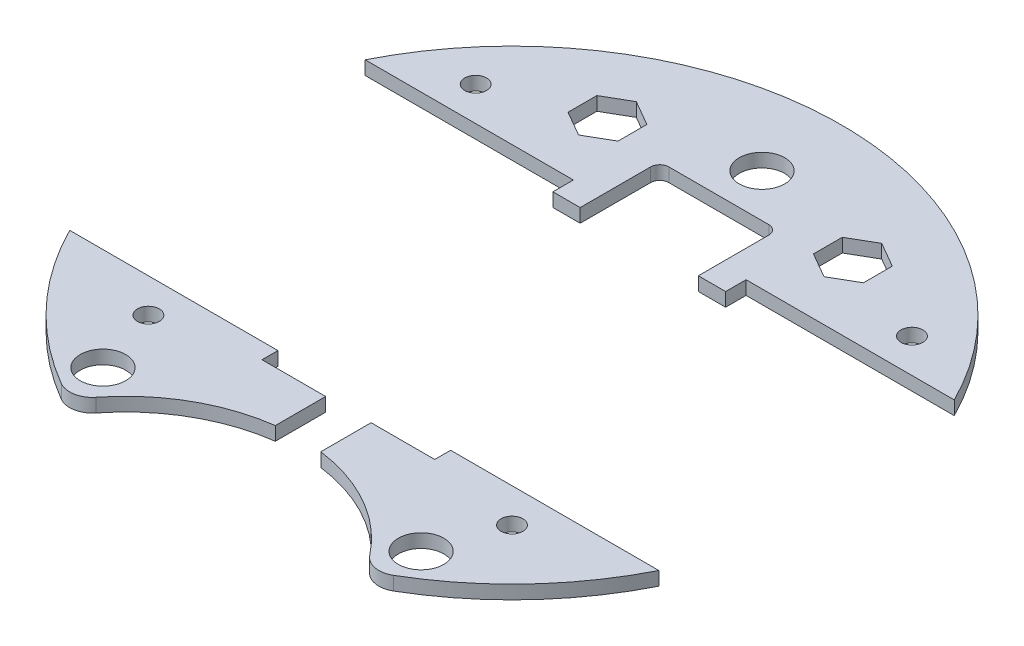
from build123d import *

# Parameters (mm, degrees)
BOSS_EXTRUDE1_DEPTH      = 3
SOLENOID_PLACEMENT_W     = 38
SOLENOID_PLACEMENT_H     = 64
CUT_EXTRUDE1_DEPTH       = 103.574363269
CUT_EXTRUDE4_DEPTH       = 103.574363269
CUT_EXTRUDE5_DEPTH       = 103.574363269
SKETCH6_R                = 2.4
CUT_EXTRUDE6_DEPTH       = 103.574363269
CUT_EXTRUDE3_DEPTH       = 103.574363269
SKETCH7_W                = 10
SKETCH7_H                = 50
CUT_EXTRUDE7_DEPTH       = 98.289516393
SKETCH9_R                = 5
CUT_EXTRUDE11_DEPTH      = 98.289516393
CUT_EXTRUDE12_DEPTH      = 98.289516393
CUT_EXTRUDE12_DEPTH_BACK = 98.289516393
SKETCH10_R               = 5


with BuildPart() as part:
    # Sketch1 → Boss-Extrude1 (new body)
    with BuildSketch(Plane(origin=(0, 0, 0), x_dir=(1, 0, 0), z_dir=(0, 1, 0))):
        with BuildLine():
            ThreePointArc((36.543377003, -62.616544118), (0, 72.5), (-36.543377003, -62.616544118))
            ThreePointArc((-36.543377003, -62.616544118), (-33.085954668, -63.20954405), (-30.089832649, -61.38507948))
            ThreePointArc((-30.089832649, -61.38507948), (0, -46.75), (30.089832649, -61.38507948))
            ThreePointArc((30.089832649, -61.38507948), (33.085954668, -63.20954405), (36.543377003, -62.616544118))
        make_face()
    extrude(amount=BOSS_EXTRUDE1_DEPTH)

    # solenoid placement → Cut-Extrude1 (cut, through all)
    with BuildSketch(Plane(origin=(0, 3, 0), x_dir=(1, 0, 0), z_dir=(0, 1, 0))):
        with Locations((0, -4)):
            Rectangle(SOLENOID_PLACEMENT_W, SOLENOID_PLACEMENT_H)
    extrude(amount=-CUT_EXTRUDE1_DEPTH, mode=Mode.SUBTRACT)

    # Sketch4 → Cut-Extrude4 (cut, through all)
    with BuildSketch(Plane(origin=(0, 3, 0), x_dir=(1, 0, 0), z_dir=(0, 1, 0))):
        with BuildLine():
            Line((-13, 28), (13, 28))
            Line((13, 28), (13, 43.5))
            ThreePointArc((13, 43.5), (12.414213562, 44.914213562), (11, 45.5))
            Line((11, 45.5), (-11, 45.5))
            ThreePointArc((-11, 45.5), (-12.414213562, 44.914213562), (-13, 43.5))
            Line((-13, 43.5), (-13, 28))
        make_face()
    extrude(amount=-CUT_EXTRUDE4_DEPTH, mode=Mode.SUBTRACT)

    # Sketch5 → Cut-Extrude5 (cut, through all)
    with BuildSketch(Plane(origin=(0, 3, 0), x_dir=(1, 0, 0), z_dir=(0, 1, 0))):
        Polygon((-21.5, 51.175426481), (-27, 54.350852961), (-32.5, 51.175426481), (-32.5, 44.824573519), (-27, 41.649147039), (-21.5, 44.824573519), align=None)
        Polygon((21.5, 44.824573519), (21.5, 51.175426481), (27, 54.350852961), (32.5, 51.175426481), (32.5, 44.824573519), (27, 41.649147039), align=None)
    extrude(amount=-CUT_EXTRUDE5_DEPTH, mode=Mode.SUBTRACT)

    # Sketch6 → Cut-Extrude6 (cut, through all)
    with BuildSketch(Plane(origin=(0, 3, 0), x_dir=(1, 0, 0), z_dir=(0, 1, 0))):
        with Locations((40, -40)):
            Circle(SKETCH6_R)
        with Locations((-40, -40)):
            Circle(SKETCH6_R)
        with Locations((48, 40)):
            Circle(SKETCH6_R)
        with Locations((-48, 40)):
            Circle(SKETCH6_R)
    extrude(amount=-CUT_EXTRUDE6_DEPTH, mode=Mode.SUBTRACT)

    # Sketch3 → Cut-Extrude3 (cut, through all)
    with BuildSketch(Plane(origin=(0, 3, 0), x_dir=(1, 0, 0), z_dir=(0, 1, 0))):
        Polygon((-19, 28), (-19, 32.5), (-72.5, 32.5), (-72.5, -32.5), (72.5, -32.5), (72.5, 32.5), (19, 32.5), (19, 28), align=None)
    extrude(amount=-CUT_EXTRUDE3_DEPTH, mode=Mode.SUBTRACT)


with BuildPart() as cut_extrude3_piece_1:
    # of the separate pieces the step leaves, piece 1, a body of its own (cut_extrude3_pieces)
    add(part.part.solids().sort_by_distance((64.807406984, 0, -32.5))[0])

    # Sketch10 → Cut-Extrude12 (cut, two sides: drawn at the far end of the back side and taken through both)
    with BuildSketch(Plane(origin=(0, 3, 0), x_dir=(1, 0, 0), z_dir=(0, 1, 0)).offset(-CUT_EXTRUDE12_DEPTH_BACK)):
        with Locations((0, 55)):
            Circle(SKETCH10_R)
    extrude(amount=CUT_EXTRUDE12_DEPTH + CUT_EXTRUDE12_DEPTH_BACK, mode=Mode.SUBTRACT)


with BuildPart() as cut_extrude3_piece_2:
    # of the separate pieces the step leaves, piece 2, a body of its own (cut_extrude3_pieces)
    add(part.part.solids().sort_by_distance((-36.543377003, 0, 62.616544118))[0])

    # Sketch7 → Cut-Extrude7 (cut, through all)
    with BuildSketch(Plane(origin=(0, 3, 0), x_dir=(1, 0, 0), z_dir=(0, 1, 0))):
        with Locations((0, -25)):
            Rectangle(SKETCH7_W, SKETCH7_H)
    extrude(amount=-CUT_EXTRUDE7_DEPTH, mode=Mode.SUBTRACT)


with BuildPart() as cut_extrude7_piece_1:
    # of the separate pieces the step leaves, piece 1, a body of its own (cut_extrude7_pieces)
    add(cut_extrude3_piece_2.part.solids().sort_by_distance((-36.543377003, 0, 62.616544118))[0])


with BuildPart() as cut_extrude7_piece_2:
    # of the separate pieces the step leaves, piece 2, a body of its own (cut_extrude7_pieces)
    add(cut_extrude3_piece_2.part.solids().sort_by_distance((5, 0, 47.078205475))[0])


with BuildPart() as cut_extrude11_tool:
    # Sketch9 → Cut-Extrude11 (new, through all)
    with BuildSketch(Plane.XZ.offset(-3)):
        with Locations((35, 55)):
            Circle(SKETCH9_R)
        with Locations((-35, 55)):
            Circle(SKETCH9_R)
    extrude(amount=CUT_EXTRUDE11_DEPTH)


with BuildPart() as cut_extrude7_piece_1_1:
    add(cut_extrude7_piece_1.part)

    # Cut-Extrude11: cut by cut_extrude11_tool
    add(cut_extrude11_tool.part, mode=Mode.SUBTRACT)


with BuildPart() as cut_extrude7_piece_2_1:
    add(cut_extrude7_piece_2.part)

    # Cut-Extrude11: cut by cut_extrude11_tool
    add(cut_extrude11_tool.part, mode=Mode.SUBTRACT)


solid = Compound([cut_extrude3_piece_1.part, cut_extrude7_piece_1_1.part, cut_extrude7_piece_2_1.part])
